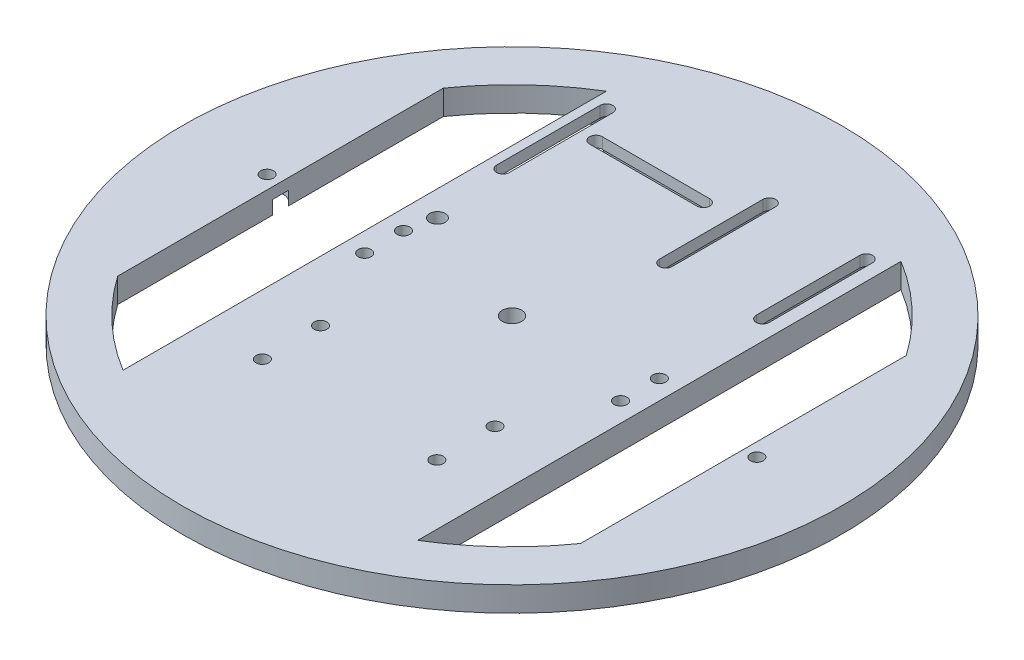
from build123d import *

# Parameters (mm, degrees)
SKETCH1_R                       = 85
SKETCH1_R_2                     = 2.5
SKETCH1_R_3                     = 2
BOSS_EXTRUDE1_DEPTH             = 6.35
CBORE_FOR_M3_SHCS1_D            = 3.3
CBORE_FOR_M3_SHCS1_CBORE_D      = 8
CBORE_FOR_M3_SHCS1_CBORE_DEPTH  = 3.5
CBORE_FOR_M3_SHCS2_D            = 3.3
CBORE_FOR_M3_SHCS2_CBORE_D      = 8
CBORE_FOR_M3_SHCS2_CBORE_DEPTH  = 3.5
CBORE_SLOT_FOR_M3_SHCS1_DEPTH   = 3.5
CBORE_START                     = 3.5
CBORE_SLOT_FOR_M3_SHCS1_2_DEPTH = 2.85
CBORE_SLOT_FOR_M3_SHCS2_DEPTH   = 3.5
CBORE_SLOT_FOR_M3_SHCS2_2_DEPTH = 2.85
SKETCH16_R                      = 1.65
CUT_EXTRUDE1_DEPTH              = 1


# Read off the part's stored shape, not the designer's step: CBORE SLOT for M3 SHCS1, CBORE SLOT for M3 SHCS2
with BuildPart() as part:
    # Sketch1 → Boss-Extrude1 (new body)
    with BuildSketch(Plane(origin=(0, 0, 0), x_dir=(1, 0, 0), z_dir=(0, 1, 0))):
        with Locations(Location((0, 0, 0), (0, 0, 270))):
            Circle(SKETCH1_R)
        with Locations(Location((0, 0, 0), (0, 0, 270))):
            Circle(SKETCH1_R_2, mode=Mode.SUBTRACT)
        with Locations(Location((-31.48, 12.25, 0), (0, 0, 270))):
            Circle(SKETCH1_R_3, mode=Mode.SUBTRACT)
        with BuildLine():
            Line((-38, 62.329768169), (-38, -62.329768169))
            ThreePointArc((-38, -62.329768169), (-49.900096859, -53.282082668), (-59.707620954, -42))
            Line((-59.707620954, -42), (-59.707620954, 42))
            ThreePointArc((-59.707620954, 42), (-49.900096859, 53.282082668), (-38, 62.329768169))
        make_face(mode=Mode.SUBTRACT)
        with BuildLine():
            Line((38, 62.329768169), (38, -62.329768169))
            ThreePointArc((38, -62.329768169), (49.900096859, -53.282082668), (59.707620954, -42))
            Line((59.707620954, -42), (59.707620954, 42))
            ThreePointArc((59.707620954, 42), (49.900096859, 53.282082668), (38, 62.329768169))
        make_face(mode=Mode.SUBTRACT)
    extrude(amount=BOSS_EXTRUDE1_DEPTH)

    # CBORE for M3 SHCS1 (through all)
    with Locations(Plane(origin=(0, 0, 0), x_dir=(-1, 0, 0), z_dir=(0, -1, 0))):
        with Locations((-33, 5), (-33, -5), (33, 5), (33, -5), (63.157620954, 0), (-63.157620954, 0)):
            CounterBoreHole(CBORE_FOR_M3_SHCS1_D / 2, CBORE_FOR_M3_SHCS1_CBORE_D / 2, CBORE_FOR_M3_SHCS1_CBORE_DEPTH)

    # CBORE for M3 SHCS2 (through all)
    with Locations(Plane(origin=(0, 0, 0), x_dir=(-1, 0, 0), z_dir=(0, -1, 0))):
        with Locations((22.5, -26.887097638), (-22.5, -26.887097638), (22.5, -41.887097638), (-22.5, -41.887097638)):
            CounterBoreHole(CBORE_FOR_M3_SHCS2_D / 2, CBORE_FOR_M3_SHCS2_CBORE_D / 2, CBORE_FOR_M3_SHCS2_CBORE_DEPTH)

    # CBORE SLOT for M3 SHCS1 outline → CBORE SLOT for M3 SHCS1 (cut)
    with BuildSketch(Plane(origin=(0, 0, 0), x_dir=(1, 0, 0), z_dir=(0, 1, 0))):
        with BuildLine():
            ThreePointArc((-30, 58.35), (-34, 62.35), (-38, 58.35))
            Line((-38, 58.35), (-38, 31.65))
            ThreePointArc((-38, 31.65), (-34, 27.65), (-30, 31.65))
            Line((-30, 31.65), (-30, 58.35))
        make_face()
        with BuildLine():
            ThreePointArc((12, 58.35), (8, 62.35), (4, 58.35))
            Line((4, 58.35), (4, 31.65))
            ThreePointArc((4, 31.65), (8, 27.65), (12, 31.65))
            Line((12, 31.65), (12, 58.35))
        make_face()
        with BuildLine():
            ThreePointArc((37, 58.35), (33, 62.35), (29, 58.35))
            Line((29, 58.35), (29, 31.65))
            ThreePointArc((29, 31.65), (33, 27.65), (37, 31.65))
            Line((37, 31.65), (37, 58.35))
        make_face()
    extrude(amount=CBORE_SLOT_FOR_M3_SHCS1_DEPTH, mode=Mode.SUBTRACT)

    # CBORE SLOT for M3 SHCS1 2 outline → CBORE SLOT for M3 SHCS1 2 (cut)
    with BuildSketch(Plane(origin=(0, 0, 0), x_dir=(1, 0, 0), z_dir=(0, 1, 0)).offset(CBORE_START)):
        with BuildLine():
            ThreePointArc((-32.35, 58.35), (-34, 60), (-35.65, 58.35))
            Line((-35.65, 58.35), (-35.65, 31.65))
            ThreePointArc((-35.65, 31.65), (-34, 30), (-32.35, 31.65))
            Line((-32.35, 31.65), (-32.35, 58.35))
        make_face()
        with BuildLine():
            ThreePointArc((9.65, 58.35), (8, 60), (6.35, 58.35))
            Line((6.35, 58.35), (6.35, 31.65))
            ThreePointArc((6.35, 31.65), (8, 30), (9.65, 31.65))
            Line((9.65, 31.65), (9.65, 58.35))
        make_face()
        with BuildLine():
            ThreePointArc((34.65, 58.35), (33, 60), (31.35, 58.35))
            Line((31.35, 58.35), (31.35, 31.65))
            ThreePointArc((31.35, 31.65), (33, 30), (34.65, 31.65))
            Line((34.65, 31.65), (34.65, 58.35))
        make_face()
    extrude(amount=CBORE_SLOT_FOR_M3_SHCS1_2_DEPTH, mode=Mode.SUBTRACT)

    # CBORE SLOT for M3 SHCS2 outline → CBORE SLOT for M3 SHCS2 (cut)
    with BuildSketch(Plane(origin=(0, 0, 0), x_dir=(1, 0, 0), z_dir=(0, 1, 0))):
        with BuildLine():
            ThreePointArc((-28.35, 54), (-29.194001893, 53.909943836), (-30, 53.643830402))
            Line((-30, 53.643830402), (-30, 46.356169598))
            ThreePointArc((-30, 46.356169598), (-29.194001893, 46.090056164), (-28.35, 46))
            Line((-28.35, 46), (-0.65, 46))
            ThreePointArc((-0.65, 46), (3.35, 50), (-0.65, 54))
            Line((-0.65, 54), (-28.35, 54))
        make_face()
    extrude(amount=CBORE_SLOT_FOR_M3_SHCS2_DEPTH, mode=Mode.SUBTRACT)

    # CBORE SLOT for M3 SHCS2 2 outline → CBORE SLOT for M3 SHCS2 2 (cut)
    with BuildSketch(Plane(origin=(0, 0, 0), x_dir=(1, 0, 0), z_dir=(0, 1, 0)).offset(CBORE_START)):
        with BuildLine():
            ThreePointArc((-28.35, 51.65), (-30, 50), (-28.35, 48.35))
            Line((-28.35, 48.35), (-0.65, 48.35))
            ThreePointArc((-0.65, 48.35), (1, 50), (-0.65, 51.65))
            Line((-0.65, 51.65), (-28.35, 51.65))
        make_face()
    extrude(amount=CBORE_SLOT_FOR_M3_SHCS2_2_DEPTH, mode=Mode.SUBTRACT)

    # Sketch16 → Cut-Extrude1 (cut)
    with BuildSketch(Plane.XZ):
        with Locations(Location((0, -70, 0), (0, 0, 270))):
            Circle(SKETCH16_R)
        with Locations(Location((0, 70, 0), (0, 0, 90))):
            Circle(SKETCH16_R)
    extrude(amount=-CUT_EXTRUDE1_DEPTH, mode=Mode.SUBTRACT)


solid = part.part
